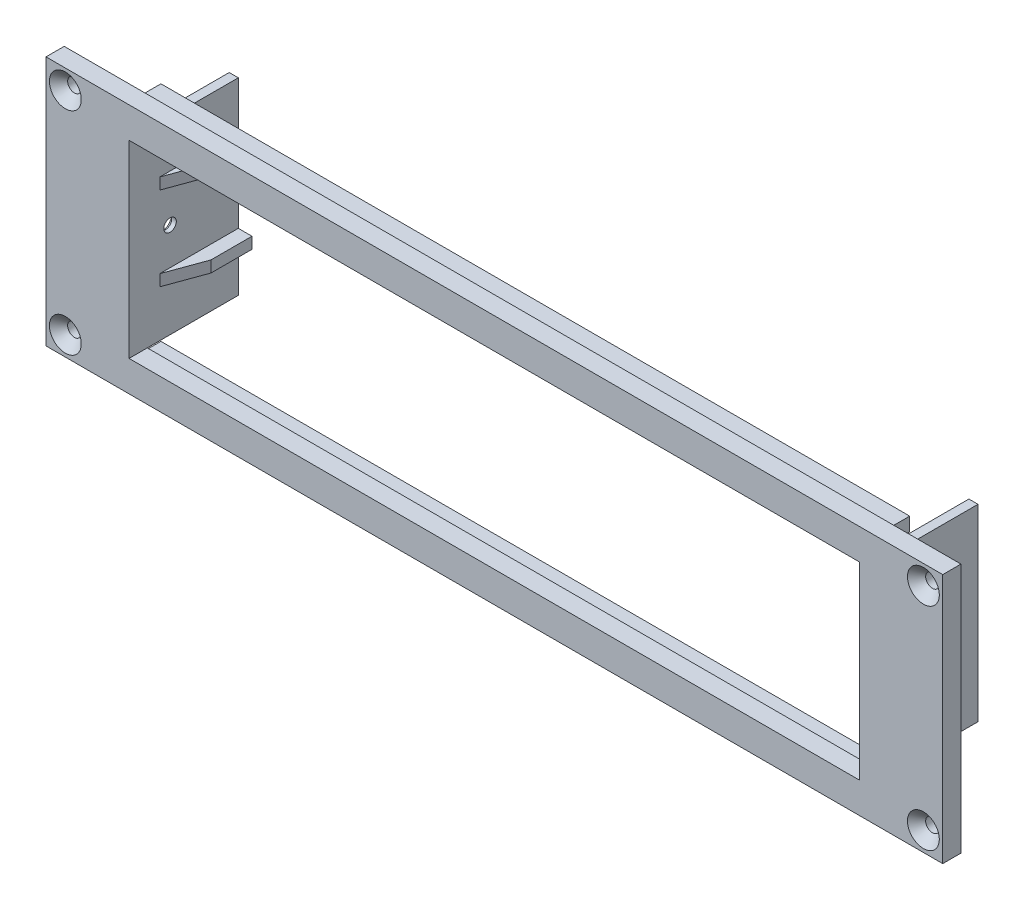
from build123d import *

# Parameters (mm, degrees)
ESQUISSE1_W             = 197
ESQUISSE1_H             = 55
BOSS_EXTRU_1_DEPTH      = 4
ESQUISSE3_R             = 1.5
ENL_V_MAT_EXTRU_2_DEPTH = 4
CHANFREIN1_SIZE         = 2
ESQUISSE4_W             = 160.5
ESQUISSE4_H             = 41.5
ENL_V_MAT_EXTRU_3_DEPTH = 10
ESQUISSE5_W             = 2
ESQUISSE5_H             = 41.395615901
ESQUISSE5_H_2           = 41.375
BOSS_EXTRU_2_DEPTH      = 20
ESQUISSE6_W             = 20
ESQUISSE6_H             = 2.5
BOSS_EXTRU_3_DEPTH      = 3
ESQUISSE7_W             = 20
ESQUISSE7_H             = 2.5
BOSS_EXTRU_4_DEPTH      = 3
CHANFREIN3_SIZE         = 4
CHANFREIN3_SIZE_2       = 10.989909678
ESQUISSE8_R             = 1.375
ENL_V_MAT_EXTRU_4_DEPTH = 900
CHANFREIN4_SIZE         = 1
ESQUISSE9_W             = 164.5
ESQUISSE9_H             = 3
BOSS_EXTRU_5_DEPTH      = 5


with BuildPart() as part:
    # Esquisse1 → Boss.-Extru.1 (new body)
    with BuildSketch(Plane.XY):
        with Locations((98.5, 27.5)):
            Rectangle(ESQUISSE1_W, ESQUISSE1_H)
    extrude(amount=BOSS_EXTRU_1_DEPTH)

    # Esquisse3 → Enlèv. mat.-Extru.2 (cut)
    with BuildSketch(Plane.XY.offset(4)):
        with Locations((4.25, 50.75)):
            Circle(ESQUISSE3_R)
        with Locations((4.25, 4.25)):
            Circle(ESQUISSE3_R)
        with Locations((192.75, 4.25)):
            Circle(ESQUISSE3_R)
        with Locations((192.75, 50.75)):
            Circle(ESQUISSE3_R)
    extrude(amount=-ENL_V_MAT_EXTRU_2_DEPTH, mode=Mode.SUBTRACT)

    # Chanfrein1
    chanfrein1_edges = [part.edges().sort_by_distance(p)[0] for p in [
        (2.75, 50.75, 4),
        (2.75, 4.25, 4),
        (191.25, 4.25, 4),
        (191.25, 50.75, 4),
    ]]
    chamfer(chanfrein1_edges, length=CHANFREIN1_SIZE)

    # Esquisse4 → Enlèv. mat.-Extru.3 (cut)
    with BuildSketch(Plane.XY.offset(4)):
        with Locations((98.5, 27.5)):
            Rectangle(ESQUISSE4_W, ESQUISSE4_H)
    extrude(amount=-ENL_V_MAT_EXTRU_3_DEPTH, mode=Mode.SUBTRACT)

    # Esquisse5 → Boss.-Extru.2 (add)
    with BuildSketch(Plane(origin=(0, 0, 0), x_dir=(-1, 0, 0), z_dir=(0, 0, -1))):
        with Locations((-17.25, 27.447807951)):
            Rectangle(ESQUISSE5_W, ESQUISSE5_H)
        with Locations((-179.75, 27.5625)):
            Rectangle(ESQUISSE5_W, ESQUISSE5_H_2)
    extrude(amount=BOSS_EXTRU_2_DEPTH)

    # Esquisse6 → Boss.-Extru.3 (add)
    with BuildSketch(Plane.ZY.offset(-178.75)):
        with Locations((-10, 18.375)):
            Rectangle(ESQUISSE6_W, ESQUISSE6_H)
        with Locations((-10, 36.75)):
            Rectangle(ESQUISSE6_W, ESQUISSE6_H)
    extrude(amount=BOSS_EXTRU_3_DEPTH)

    # Esquisse7 → Boss.-Extru.4 (add)
    with BuildSketch(Plane(origin=(18.25, 0, 0), x_dir=(0, 0, -1), z_dir=(1, 0, 0))):
        with Locations((10, 18.25)):
            Rectangle(ESQUISSE7_W, ESQUISSE7_H)
        with Locations((10, 36.645615901)):
            Rectangle(ESQUISSE7_W, ESQUISSE7_H)
    extrude(amount=BOSS_EXTRU_4_DEPTH)

    # Chanfrein3
    # the kernel refuses this chamfer: 10.989909678, 4 mm, written as the material it takes off along each edge
    with BuildSketch(Plane(origin=(21.25, 48.009965797, 0), x_dir=(-0.9950833631817486, 0, 0.0990409022520506), z_dir=(0, -1, 0))) as chanfrein3_piece_1_section:
        Polygon((CHANFREIN3_SIZE * 0.995083363182, CHANFREIN3_SIZE * 0.0990409022521), (-CHANFREIN3_SIZE_2 * 0.0990409022504, CHANFREIN3_SIZE_2 * 0.995083363165), (0, 0), align=None)
    chanfrein3_piece_1 = extrude(amount=59.519931595, mode=Mode.PRIVATE)
    chanfrein3_piece_1 = split(chanfrein3_piece_1, bisect_by=Plane(origin=(18.25, 18.25, -4.010147901), z_dir=(1, 0, 0)), keep=Keep.TOP, mode=Mode.PRIVATE)
    add(chanfrein3_piece_1, mode=Mode.SUBTRACT)
    with BuildSketch(Plane(origin=(21.25, 6.885650104, 0), x_dir=(-0.9950833631817486, 0, 0.0990409022520506), z_dir=(0, 1, 0))) as chanfrein3_piece_2_section:
        Polygon((CHANFREIN3_SIZE * 0.995083363182, -CHANFREIN3_SIZE * 0.0990409022521), (-CHANFREIN3_SIZE_2 * 0.0990409022504, -CHANFREIN3_SIZE_2 * 0.995083363165), (0, 0), align=None)
    chanfrein3_piece_2 = extrude(amount=59.519931595, mode=Mode.PRIVATE)
    chanfrein3_piece_2 = split(chanfrein3_piece_2, bisect_by=Plane(origin=(18.25, 36.645615901, -4.010147901), z_dir=(1, 0, 0)), keep=Keep.TOP, mode=Mode.PRIVATE)
    add(chanfrein3_piece_2, mode=Mode.SUBTRACT)
    with BuildSketch(Plane(origin=(175.75, 66.509965797, 0), x_dir=(0.9950833631817486, 0, 0.09904090225205044), z_dir=(0, -1, 0))) as chanfrein3_piece_3_section:
        Polygon((CHANFREIN3_SIZE * 0.995083363182, -CHANFREIN3_SIZE * 0.0990409022521), (-CHANFREIN3_SIZE_2 * 0.0990409022504, -CHANFREIN3_SIZE_2 * 0.995083363165), (0, 0), align=None)
    chanfrein3_piece_3 = extrude(amount=59.519931595, mode=Mode.PRIVATE)
    chanfrein3_piece_3 = split(chanfrein3_piece_3, bisect_by=Plane(origin=(178.75, 36.75, -4.010147901), z_dir=(-1, 0, 0)), keep=Keep.TOP, mode=Mode.PRIVATE)
    add(chanfrein3_piece_3, mode=Mode.SUBTRACT)
    with BuildSketch(Plane(origin=(175.75, 48.134965797, 0), x_dir=(0.9950833631817486, 0, 0.09904090225205044), z_dir=(0, -1, 0))) as chanfrein3_piece_4_section:
        Polygon((CHANFREIN3_SIZE * 0.995083363182, -CHANFREIN3_SIZE * 0.0990409022521), (-CHANFREIN3_SIZE_2 * 0.0990409022504, -CHANFREIN3_SIZE_2 * 0.995083363165), (0, 0), align=None)
    chanfrein3_piece_4 = extrude(amount=59.519931595, mode=Mode.PRIVATE)
    chanfrein3_piece_4 = split(chanfrein3_piece_4, bisect_by=Plane(origin=(178.75, 18.375, -4.010147901), z_dir=(-1, 0, 0)), keep=Keep.TOP, mode=Mode.PRIVATE)
    add(chanfrein3_piece_4, mode=Mode.SUBTRACT)

    # Esquisse8 → Enlèv. mat.-Extru.4 (cut)
    with BuildSketch(Plane(origin=(180.75, 0, 0), x_dir=(0, 0, -1), z_dir=(1, 0, 0))):
        with Locations((5, 27.62)):
            Circle(ESQUISSE8_R)
    extrude(amount=-ENL_V_MAT_EXTRU_4_DEPTH, mode=Mode.SUBTRACT)

    # Chanfrein4
    chanfrein4_edges = [part.edges().sort_by_distance(p)[0] for p in [
        (16.25, 27.62, -3.625),
        (180.75, 27.62, -3.625),
    ]]
    chamfer(chanfrein4_edges, length=CHANFREIN4_SIZE)

    # Esquisse9 → Boss.-Extru.5 (add)
    with BuildSketch(Plane(origin=(0, 0, 0), x_dir=(-1, 0, 0), z_dir=(0, 0, -1))):
        with Locations((-98.5, 52)):
            Rectangle(ESQUISSE9_W, ESQUISSE9_H)
        with Locations((-98.5, 3)):
            Rectangle(ESQUISSE9_W, ESQUISSE9_H)
    extrude(amount=BOSS_EXTRU_5_DEPTH)


solid = part.part
